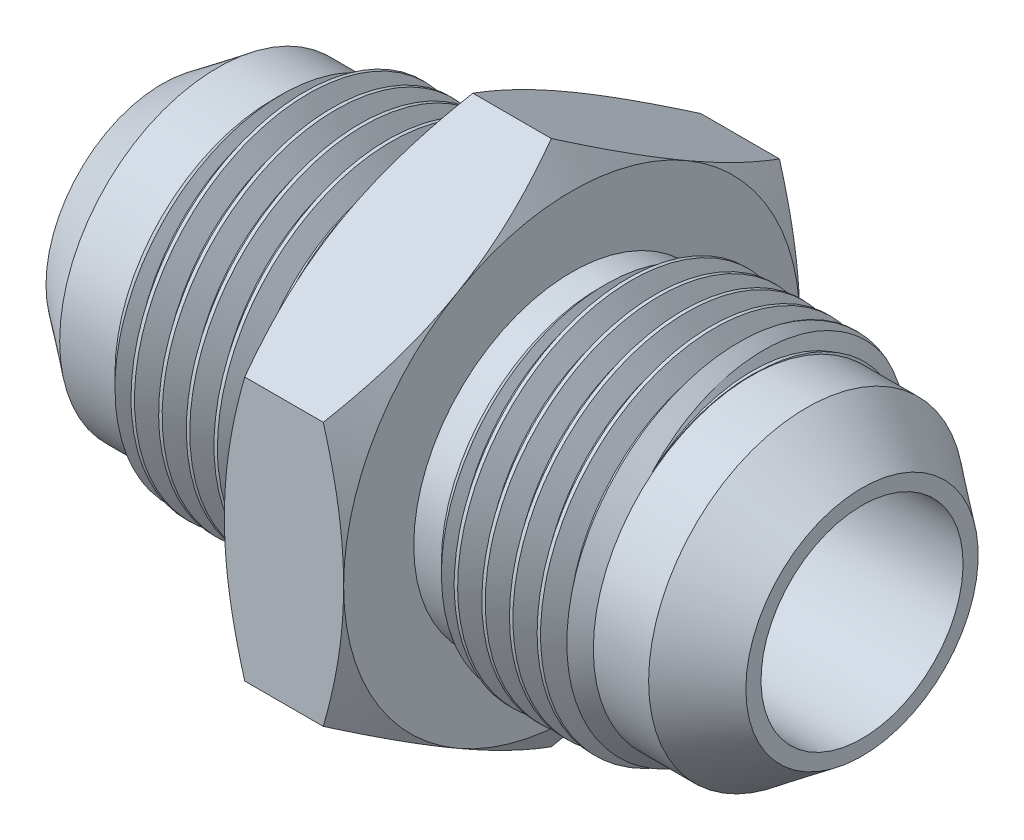
from build123d import *

# Parameters (mm, degrees)
SKETCH6_W         = 53.578125
SKETCH6_H         = 13.49375
CUT_SWEEP1_PITCH  = 2.116666667
CIRPATTERN1_COUNT = 2
EXTRUDE1_DEPTH    = 9.128125
SKETCH7_W         = 53.578125
SKETCH7_H         = 7.7343


with BuildPart() as part:
    # Sketch6 → Revolve3 (revolve)
    with BuildSketch(Plane.XY, mode=Mode.PRIVATE) as revolve3_sk:
        with Locations((0, 6.746875)):
            Rectangle(SKETCH6_W, SKETCH6_H)
    revolve(revolve3_sk.sketch.rotate(Axis((-26.7890625, 0, 0), (1, 0, 0)), 90), axis=Axis((-26.7890625, 0, 0), (1, 0, 0)))

    # Cut-Sweep1: the profile of Sketch15 profile screwed along a right-hand helix of 11.5 turns, 10 arcs to a turn; built about Z, then put on its axis
    cut_sweep1_z = Axis((0, 0, 0), (0, 0, 1))
    cut_sweep1_corners = [(13.49405, 0, -1.852256538), (13.49405, 0, 0.000173205), (12.118934671, 0, -0.79375), (12.118934671, 0, -1.058333333)]
    with BuildLine(mode=Mode.PRIVATE) as cut_sweep1_profile:
        Line(cut_sweep1_corners[0], cut_sweep1_corners[1])
        Line(cut_sweep1_corners[1], cut_sweep1_corners[2])
        Line(cut_sweep1_corners[2], cut_sweep1_corners[3])
        Line(cut_sweep1_corners[3], cut_sweep1_corners[0])
    cut_sweep1_cap = Face(cut_sweep1_profile.wire())
    cut_sweep1_turn_angles = [0, 18, 36, 54, 72, 90, 108, 126, 144, 162, 180, 198, 216, 234, 252, 270, 288, 306, 324, 342, 360]
    cut_sweep1_turn_weights = [1, 0.9510565162951535, 1, 0.9510565162951535, 1, 0.9510565162951535, 1, 0.9510565162951535, 1, 0.9510565162951535, 1, 0.9510565162951535, 1, 0.9510565162951535, 1, 0.9510565162951535, 1, 0.9510565162951535, 1, 0.9510565162951535, 1]
    cut_sweep1_turn_rails = [Edge.make_bspline([Vector(p[0], p[1], 0).rotate(cut_sweep1_z, cut_sweep1_turn_angles[k]) / cut_sweep1_turn_weights[k] + Vector(0, 0, p[2] + CUT_SWEEP1_PITCH * cut_sweep1_turn_angles[k] / 360) for k in range(21)], [0, 0, 0, 1, 1, 2, 2, 3, 3, 4, 4, 5, 5, 6, 6, 7, 7, 8, 8, 9, 9, 10, 10, 10], 2, cut_sweep1_turn_weights) for p in cut_sweep1_corners]
    cut_sweep1_turn_sides = [Face.make_surface_from_curves(cut_sweep1_turn_rails[p[0]], cut_sweep1_turn_rails[p[1]]) for p in [(0, 1), (1, 2), (2, 3), (3, 0)]]
    cut_sweep1_last_angles = [3960, 3978, 3996, 4014, 4032, 4050, 4068, 4086, 4104, 4122, 4140]
    cut_sweep1_last_weights = [1, 0.9510565162951535, 1, 0.9510565162951535, 1, 0.9510565162951535, 1, 0.9510565162951535, 1, 0.9510565162951781, 1]
    cut_sweep1_last_rails = [Edge.make_bspline([Vector(p[0], p[1], 0).rotate(cut_sweep1_z, cut_sweep1_last_angles[k]) / cut_sweep1_last_weights[k] + Vector(0, 0, p[2] + CUT_SWEEP1_PITCH * cut_sweep1_last_angles[k] / 360) for k in range(11)], [0, 0, 0, 1, 1, 2, 2, 3, 3, 4, 4, 5, 5, 5], 2, cut_sweep1_last_weights) for p in cut_sweep1_corners]
    cut_sweep1_last_sides = [Face.make_surface_from_curves(cut_sweep1_last_rails[p[0]], cut_sweep1_last_rails[p[1]]) for p in [(0, 1), (1, 2), (2, 3), (3, 0)]]
    cut_sweep1 = Plane(origin=(-26.7890625, 0, 0), x_dir=(0, 1, 0), z_dir=(1, 0, 0)) * Solid(Shell([*[p.moved(Location((0, 0, CUT_SWEEP1_PITCH * i))) for i in range(11) for p in cut_sweep1_turn_sides], *cut_sweep1_last_sides, cut_sweep1_cap, cut_sweep1_cap.rotate(cut_sweep1_z, 4140).moved(Location((0, 0, CUT_SWEEP1_PITCH * 4140 / 360)))]))
    add(cut_sweep1, mode=Mode.SUBTRACT)

    # CirPattern1: Cut-Sweep1 ×2 about axis
    cirpattern1_axis = Axis((0, 0, 13.49375), (0, 0, -1))
    for i in range(1, CIRPATTERN1_COUNT):
        add(cut_sweep1.rotate(cirpattern1_axis, i * 360 / CIRPATTERN1_COUNT), mode=Mode.SUBTRACT)

    # Sketch12 → Extrude1 (add)
    with BuildSketch(Plane(origin=(-4.5640625, 0, 0), x_dir=(0, 0, -1), z_dir=(1, 0, 0))):
        Polygon((0, 20.163958151), (-17.4625, 10.081979076), (-17.4625, -10.081979076), (0, -20.163958151), (17.4625, -10.081979076), (17.4625, 10.081979076), align=None)
    extrude(amount=EXTRUDE1_DEPTH)

    # Sketch10 → Cut-Revolve6 (revolve, cut)
    with BuildSketch(Plane.XY, mode=Mode.PRIVATE) as cut_revolve6_sk:
        Polygon((-8.080944495, 13.49375), (-6.680729167, 12.093534671), (-4.5640625, 12.093534671), (-4.5640625, 13.49375), align=None)
        Polygon((8.080944495, 13.49375), (4.5640625, 13.49375), (4.5640625, 12.093534671), (6.680729167, 12.093534671), align=None)
        Polygon((-26.7890625, 8.894445), (-26.7890625, 13.49375), (-16.910178456, 13.49375), (-18.310393784, 12.093534671), (-22.543727118, 12.093534671), align=None)
        Polygon((26.7890625, 13.49375), (16.910178456, 13.49375), (18.310393784, 12.093534671), (22.543727118, 12.093534671), (26.7890625, 8.894445), align=None)
    revolve(cut_revolve6_sk.sketch.rotate(Axis((-26.7890625, 0, 0), (1, 0, 0)), 90), axis=Axis((-26.7890625, 0, 0), (1, 0, 0)), mode=Mode.SUBTRACT)

    # Sketch7 → Cut-Revolve5 (revolve, cut)
    with BuildSketch(Plane.XY, mode=Mode.PRIVATE) as cut_revolve5_sk:
        with Locations((0, 3.86715)):
            Rectangle(SKETCH7_W, SKETCH7_H)
    revolve(cut_revolve5_sk.sketch.rotate(Axis((26.7890625, 0, 0), (-1, 0, 0)), 76.955946569), axis=Axis((26.7890625, 0, 0), (-1, 0, 0)), mode=Mode.SUBTRACT)

    # Sketch13 → Cut-Revolve7 (revolve, cut)
    with BuildSketch(Plane.XY, mode=Mode.PRIVATE) as cut_revolve7_sk:
        Polygon((-4.5640625, 20.163958151), (-4.5640625, 17.4625), (-3.004374909, 20.163958151), align=None)
        Polygon((3.004374909, 20.163958151), (4.5640625, 17.4625), (4.5640625, 20.163958151), align=None)
    revolve(cut_revolve7_sk.sketch.rotate(Axis((-26.7890625, 0, 0), (1, 0, 0)), 283.044053431), axis=Axis((-26.7890625, 0, 0), (1, 0, 0)), mode=Mode.SUBTRACT)


solid = part.part
